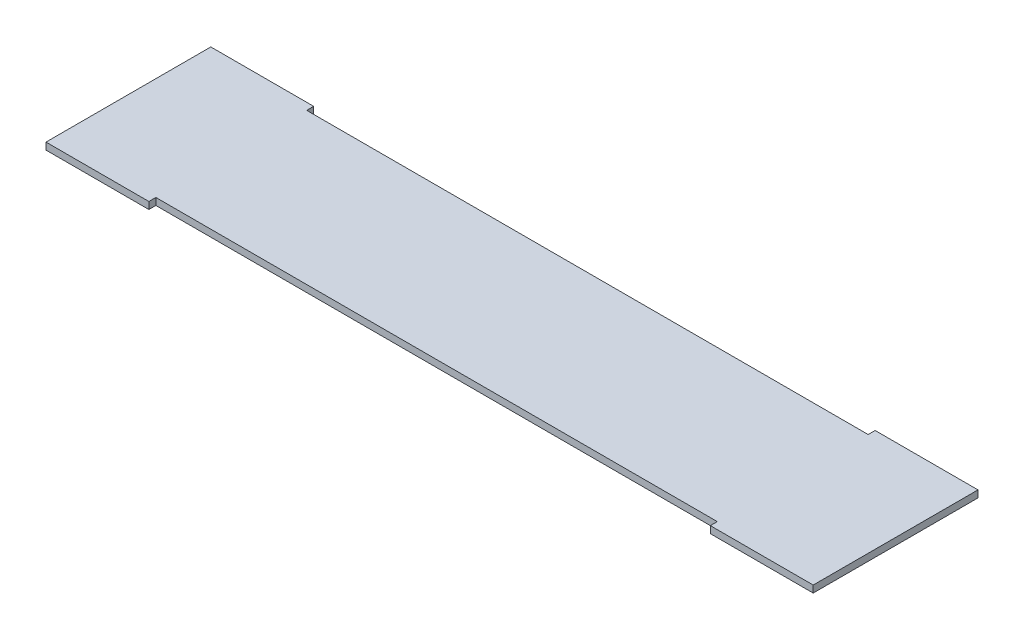
from build123d import *

# Parameters (mm, degrees)
BOSS_EXTRUDE1_DEPTH = 3.175


with BuildPart() as part:
    # Sketch1 → Boss-Extrude1 (new, symmetric)
    with BuildSketch(Plane(origin=(0, 0, 0), x_dir=(1, 0, 0), z_dir=(0, 1, 0))):
        Polygon((-349.15, 75), (-349.15, -75), (-255.5, -75), (-255.5, -68.65), (255.5, -68.65), (255.5, -75), (349.15, -75), (349.15, 75), (255.5, 75), (255.5, 68.65), (-255.5, 68.65), (-255.5, 75), align=None)
    extrude(amount=BOSS_EXTRUDE1_DEPTH, both=True)


solid = part.part
